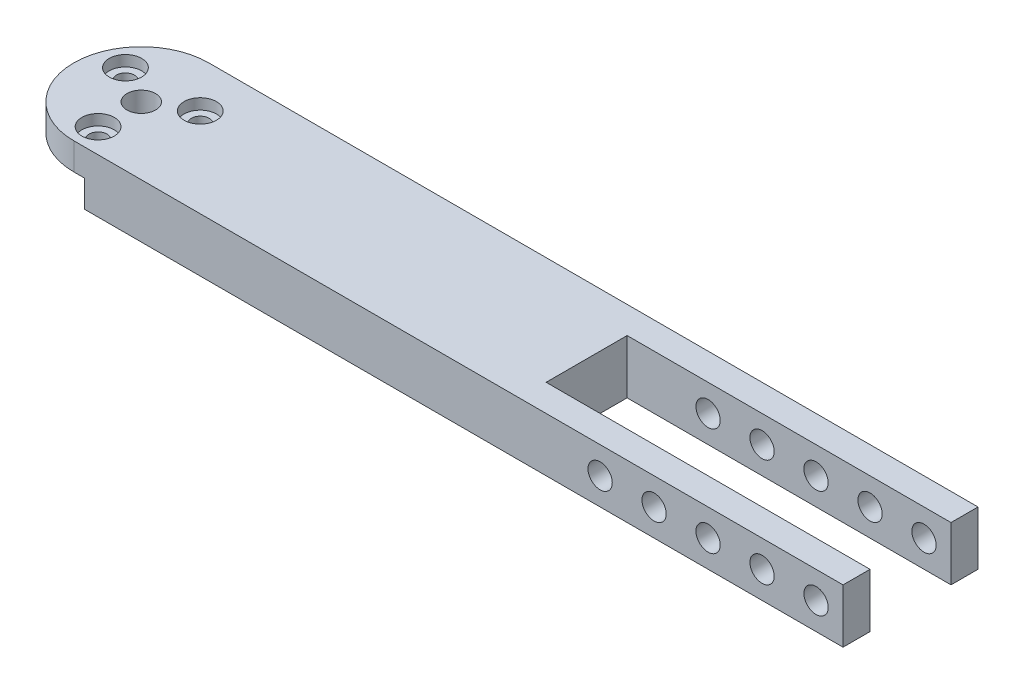
from build123d import *

# Parameters (mm, degrees)
SKETCH1_W           = 250
SKETCH1_H           = 25
BOSS_EXTRUDE1_DEPTH = 10
CUT_EXTRUDE1_REACH  = 253.446
SKETCH2_R           = 2.65
FILLET1_R           = 12.5
SKETCH3_R           = 2.25
CUT_EXTRUDE2_DEPTH  = 252.445819214
CUT_EXTRUDE5_REACH  = 253.446
SKETCH5_W           = 7.3
SKETCH5_H           = 4
SKETCH6_R           = 12.65
CUT_EXTRUDE6_DEPTH  = 5
CUT_EXTRUDE7_REACH  = 253.297
SKETCH7_R           = 1.65
SKETCH9_R           = 3
CUT_EXTRUDE9_DEPTH  = 2
CUT_EXTRUDE10_DEPTH = 252.445819214
SKETCH11_R          = 2.25
CUT_EXTRUDE11_DEPTH = 158.321327226


with BuildPart() as part:
    # Sketch1 → Boss-Extrude1 (new body)
    with BuildSketch(Plane(origin=(0, 0, 0), x_dir=(1, 0, 0), z_dir=(0, 1, 0))):
        with Locations((125, 12.5)):
            Rectangle(SKETCH1_W, SKETCH1_H)
    extrude(amount=BOSS_EXTRUDE1_DEPTH)

    # Sketch2 → Cut-Extrude1 (cut, up to next)
    with BuildSketch(Plane(origin=(0, 10, 0), x_dir=(1, 0, 0), z_dir=(0, 1, 0)), mode=Mode.PRIVATE) as cut_extrude1_sk1:
        with Locations(Location((12.5, 12.5, 0), (0, 0, 270))):
            Circle(SKETCH2_R)
    cut_extrude1_tool1 = extrude(cut_extrude1_sk1.sketch, amount=-CUT_EXTRUDE1_REACH, mode=Mode.PRIVATE) & part.part
    add(cut_extrude1_tool1.solids().sort_by_distance((12.5, 10, -12.5))[0], mode=Mode.SUBTRACT)

    # Fillet1
    fillet1_edges = [part.edges().sort_by_distance(p)[0] for p in [
        (0, 5, 0),
        (0, 5, -25),
    ]]
    fillet(fillet1_edges, radius=FILLET1_R - 0.0001)  # a hair under: the kernel refuses the full size

    # Sketch3 → Cut-Extrude2 (cut, through all)
    with BuildSketch(Plane(origin=(0, 0, -25), x_dir=(-1, 0, 0), z_dir=(0, 0, -1))):
        with Locations((-244.5, 5)):
            Circle(SKETCH3_R)
        with Locations((-230.5, 5)):
            Circle(SKETCH3_R)
    extrude(amount=-CUT_EXTRUDE2_DEPTH, mode=Mode.SUBTRACT)

    # Sketch5 → Cut-Extrude5 (cut, up to next)
    with BuildSketch(Plane(origin=(0, 10, 0), x_dir=(1, 0, 0), z_dir=(0, 1, 0)), mode=Mode.PRIVATE) as cut_extrude5_sk1:
        with Locations((244.5, 19)):
            Rectangle(SKETCH5_W, SKETCH5_H)
    cut_extrude5_tool1 = extrude(cut_extrude5_sk1.sketch, amount=-CUT_EXTRUDE5_REACH, mode=Mode.PRIVATE) & part.part
    # Sketch5 → Cut-Extrude5 (cut, up to next)
    with BuildSketch(Plane(origin=(0, 10, 0), x_dir=(1, 0, 0), z_dir=(0, 1, 0)), mode=Mode.PRIVATE) as cut_extrude5_sk2:
        with Locations((244.5, 6)):
            Rectangle(SKETCH5_W, SKETCH5_H)
    cut_extrude5_tool2 = extrude(cut_extrude5_sk2.sketch, amount=-CUT_EXTRUDE5_REACH, mode=Mode.PRIVATE) & part.part
    # Sketch5 → Cut-Extrude5 (cut, up to next)
    with BuildSketch(Plane(origin=(0, 10, 0), x_dir=(1, 0, 0), z_dir=(0, 1, 0)), mode=Mode.PRIVATE) as cut_extrude5_sk3:
        with Locations((230.5, 19)):
            Rectangle(SKETCH5_W, SKETCH5_H)
    cut_extrude5_tool3 = extrude(cut_extrude5_sk3.sketch, amount=-CUT_EXTRUDE5_REACH, mode=Mode.PRIVATE) & part.part
    # Sketch5 → Cut-Extrude5 (cut, up to next)
    with BuildSketch(Plane(origin=(0, 10, 0), x_dir=(1, 0, 0), z_dir=(0, 1, 0)), mode=Mode.PRIVATE) as cut_extrude5_sk4:
        with Locations((230.5, 6)):
            Rectangle(SKETCH5_W, SKETCH5_H)
    cut_extrude5_tool4 = extrude(cut_extrude5_sk4.sketch, amount=-CUT_EXTRUDE5_REACH, mode=Mode.PRIVATE) & part.part
    add(cut_extrude5_tool1.solids().sort_by_distance((244.5, 10, -19))[0], mode=Mode.SUBTRACT)
    add(cut_extrude5_tool2.solids().sort_by_distance((244.5, 10, -6))[0], mode=Mode.SUBTRACT)
    add(cut_extrude5_tool3.solids().sort_by_distance((230.5, 10, -19))[0], mode=Mode.SUBTRACT)
    add(cut_extrude5_tool4.solids().sort_by_distance((230.5, 10, -6))[0], mode=Mode.SUBTRACT)

    # Sketch6 → Cut-Extrude6 (cut)
    with BuildSketch(Plane.XZ):
        with Locations((12.5, -12.5)):
            Circle(SKETCH6_R)
    extrude(amount=-CUT_EXTRUDE6_DEPTH, mode=Mode.SUBTRACT)

    # Sketch7 → Cut-Extrude7 (cut, up to next)
    with BuildSketch(Plane.XZ.offset(-5), mode=Mode.PRIVATE) as cut_extrude7_sk1:
        with Locations(Location((12.5, -4.5, 0), (0, 0, 270))):
            Circle(SKETCH7_R)
    cut_extrude7_tool1 = extrude(cut_extrude7_sk1.sketch, amount=-CUT_EXTRUDE7_REACH, mode=Mode.PRIVATE) & part.part
    # Sketch7 → Cut-Extrude7 (cut, up to next)
    with BuildSketch(Plane.XZ.offset(-5), mode=Mode.PRIVATE) as cut_extrude7_sk2:
        with Locations(Location((19.42820323, -16.5, 0), (0, 0, 270))):
            Circle(SKETCH7_R)
    cut_extrude7_tool2 = extrude(cut_extrude7_sk2.sketch, amount=-CUT_EXTRUDE7_REACH, mode=Mode.PRIVATE) & part.part
    # Sketch7 → Cut-Extrude7 (cut, up to next)
    with BuildSketch(Plane.XZ.offset(-5), mode=Mode.PRIVATE) as cut_extrude7_sk3:
        with Locations(Location((5.57179677, -16.5, 0), (0, 0, 270))):
            Circle(SKETCH7_R)
    cut_extrude7_tool3 = extrude(cut_extrude7_sk3.sketch, amount=-CUT_EXTRUDE7_REACH, mode=Mode.PRIVATE) & part.part
    add(cut_extrude7_tool1.solids().sort_by_distance((12.5, 5, -4.5))[0], mode=Mode.SUBTRACT)
    add(cut_extrude7_tool2.solids().sort_by_distance((19.428203, 5, -16.5))[0], mode=Mode.SUBTRACT)
    add(cut_extrude7_tool3.solids().sort_by_distance((5.571797, 5, -16.5))[0], mode=Mode.SUBTRACT)

    # Sketch9 → Cut-Extrude9 (cut)
    with BuildSketch(Plane(origin=(0, 10, 0), x_dir=(1, 0, 0), z_dir=(0, 1, 0))):
        with Locations(Location((5.57179677, 16.5, 0), (0, 0, 270))):
            Circle(SKETCH9_R)
        with Locations(Location((12.5, 4.5, 0), (0, 0, 270))):
            Circle(SKETCH9_R)
        with Locations(Location((19.42820323, 16.5, 0), (0, 0, 270))):
            Circle(SKETCH9_R)
    extrude(amount=-CUT_EXTRUDE9_DEPTH, mode=Mode.SUBTRACT)

    # Sketch10 → Cut-Extrude10 (cut, through all)
    with BuildSketch(Plane(origin=(0, 10, 0), x_dir=(1, 0, 0), z_dir=(0, 1, 0))):
        Polygon((95, 5), (155, 5), (155, 0), (250, 0), (250, 25), (155, 25), (155, 20), (95, 20), align=None)
    extrude(amount=-CUT_EXTRUDE10_DEPTH, mode=Mode.SUBTRACT)

    # Sketch11 → Cut-Extrude11 (cut, through all)
    with BuildSketch(Plane.XY):
        with Locations((150, 5)):
            Circle(SKETCH11_R)
        with Locations((140, 5)):
            Circle(SKETCH11_R)
        with Locations((130, 5)):
            Circle(SKETCH11_R)
        with Locations((120, 5)):
            Circle(SKETCH11_R)
        with Locations((110, 5)):
            Circle(SKETCH11_R)
    extrude(amount=-CUT_EXTRUDE11_DEPTH, mode=Mode.SUBTRACT)


solid = part.part
